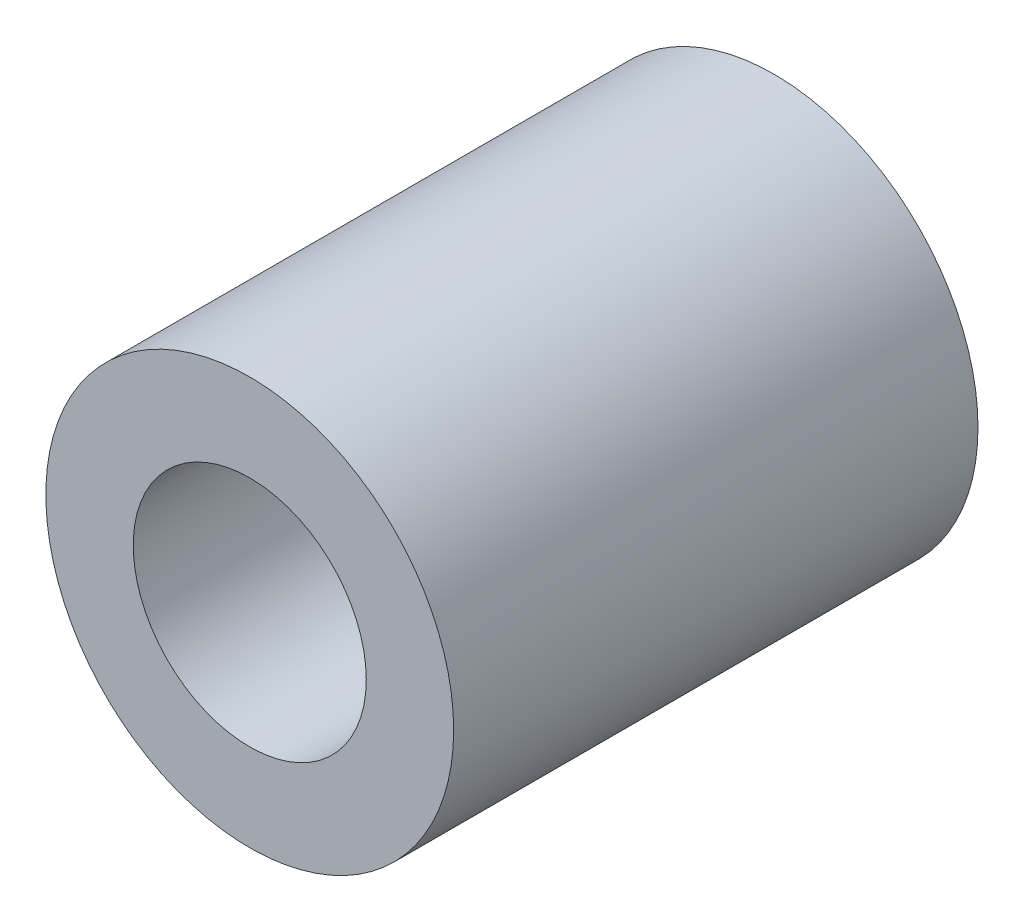
from build123d import *

# Parameters (mm, degrees)
SKETCH_1_R          = 3.5
EXTRUDE_1_DEPTH     = 10
SKETCH_2_R          = 2
CUT_EXTRUDE_1_DEPTH = 9
CUT_EXTRUDE_START   = -1
SKETCH_10_R         = 3.5
CUT_EXTRUDE_2_DEPTH = 1


with BuildPart() as part:
    # 草图1 → 凸台-拉伸1 (new body)
    with BuildSketch(Plane.XY):
        Circle(SKETCH_1_R)
    extrude(amount=EXTRUDE_1_DEPTH)

    # 草图2 → 切除-拉伸1 (cut)
    with BuildSketch(Plane.XY.offset(10)):
        Circle(SKETCH_2_R)
    extrude(amount=-CUT_EXTRUDE_1_DEPTH, mode=Mode.SUBTRACT)

    # 草图8 → 大小mm 暗销孔2 (revolve, cut)
    with BuildSketch(Plane(origin=(0, 0, 1), x_dir=(0, -1, 0), z_dir=(1, 0, 0))):
        Polygon((0, 0), (0, 1), (1, 1), (1, 0.025), (1.025, 0), align=None)
    revolve(axis=Axis((0, 0, 7.35), (0, 0, -1)), mode=Mode.SUBTRACT)

    # 草图10 → 切除-拉伸2 (cut)
    with BuildSketch(Plane.XY.offset(10).offset(CUT_EXTRUDE_START)):
        Circle(SKETCH_10_R)
    extrude(amount=CUT_EXTRUDE_2_DEPTH, mode=Mode.SUBTRACT)


solid = part.part
